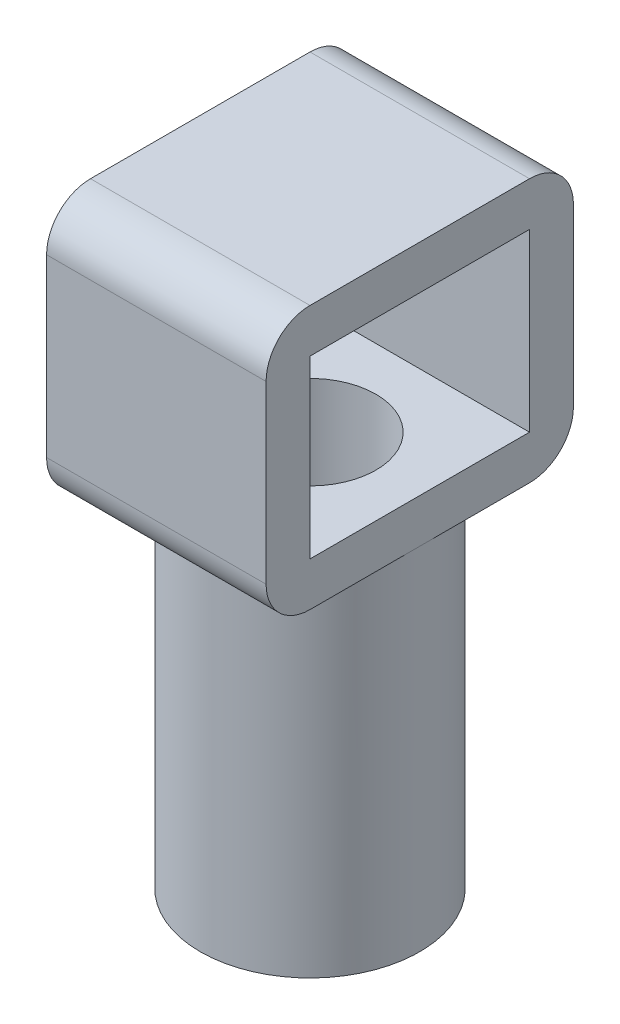
from build123d import *

# Parameters (mm, degrees)
SKETCH1_R           = 12.5
BOSS_EXTRUDE1_DEPTH = 40
SKETCH2_W           = 25
SKETCH2_H           = 35
BOSS_EXTRUDE2_DEPTH = 30
SKETCH3_W           = 25
SKETCH3_H           = 20
CUT_EXTRUDE1_DEPTH  = 77.362621747
FILLET1_R           = 5
SKETCH4_R           = 7.5
CUT_EXTRUDE2_DEPTH  = 65


with BuildPart() as part:
    # Sketch1 → Boss-Extrude1 (new body)
    with BuildSketch(Plane(origin=(0, 0, 0), x_dir=(1, 0, 0), z_dir=(0, 1, 0))):
        with Locations(Location((0, 0, 0), (0, 0, 270))):
            Circle(SKETCH1_R)
    extrude(amount=BOSS_EXTRUDE1_DEPTH)

    # Sketch2 → Boss-Extrude2 (add)
    with BuildSketch(Plane(origin=(0, 40, 0), x_dir=(1, 0, 0), z_dir=(0, 1, 0))):
        Rectangle(SKETCH2_W, SKETCH2_H)
    extrude(amount=BOSS_EXTRUDE2_DEPTH)

    # Sketch3 → Cut-Extrude1 (cut, through all)
    with BuildSketch(Plane(origin=(12.5, 0, 0), x_dir=(0, 0, -1), z_dir=(1, 0, 0))):
        with Locations((0, 55)):
            Rectangle(SKETCH3_W, SKETCH3_H)
    extrude(amount=-CUT_EXTRUDE1_DEPTH, mode=Mode.SUBTRACT)

    # Fillet1
    fillet1_edges = [part.edges().sort_by_distance(p)[0] for p in [
        (0, 40, 17.5),
        (0, 40, -17.5),
        (0, 70, 17.5),
        (0, 70, -17.5),
    ]]
    fillet(fillet1_edges, radius=FILLET1_R - 0.0001)  # a hair under: the kernel refuses the full size

    # Sketch4 → Cut-Extrude2 (cut)
    with BuildSketch(Plane.XZ):
        with Locations(Location((0, 0, 0), (0, 0, 270))):
            Circle(SKETCH4_R)
    extrude(amount=-CUT_EXTRUDE2_DEPTH, mode=Mode.SUBTRACT)


solid = part.part
